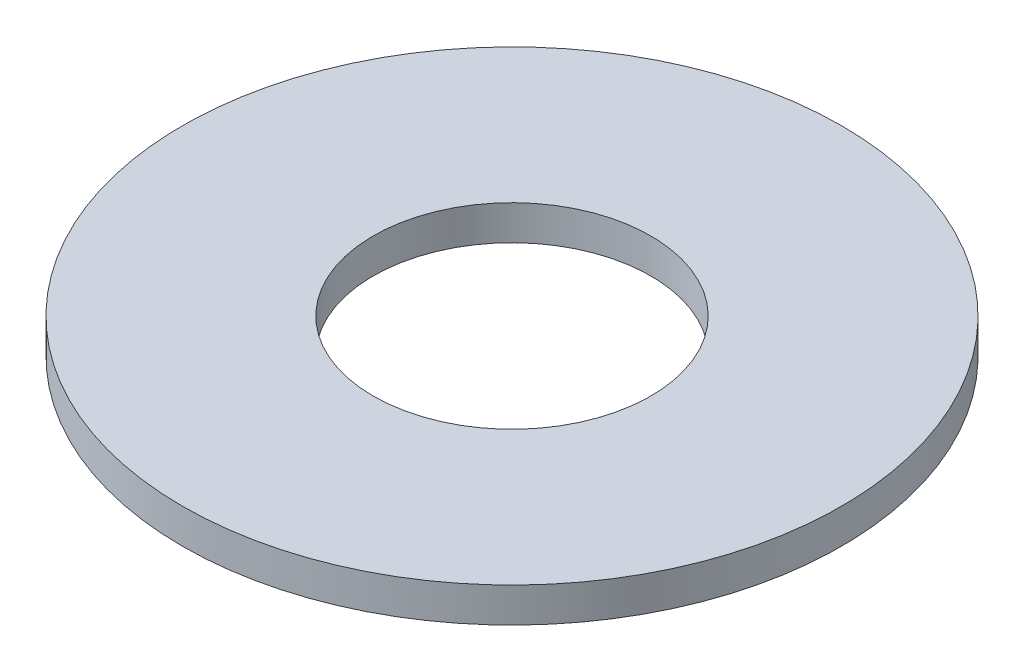
from build123d import *

# Parameters (mm, degrees)
SKETCH1_R           = 47.5
BOSS_EXTRUDE1_DEPTH = 5
SKETCH2_R           = 20
CUT_EXTRUDE1_DEPTH  = 68.360967927


with BuildPart() as part:
    # Sketch1 → Boss-Extrude1 (new body)
    with BuildSketch(Plane(origin=(0, 0, 0), x_dir=(1, 0, 0), z_dir=(0, 1, 0))):
        Circle(SKETCH1_R)
    extrude(amount=BOSS_EXTRUDE1_DEPTH)

    # Sketch2 → Cut-Extrude1 (cut, through all)
    with BuildSketch(Plane(origin=(0, 0, 0), x_dir=(1, 0, 0), z_dir=(0, 1, 0))):
        Circle(SKETCH2_R)
    extrude(amount=CUT_EXTRUDE1_DEPTH, mode=Mode.SUBTRACT)


solid = part.part
